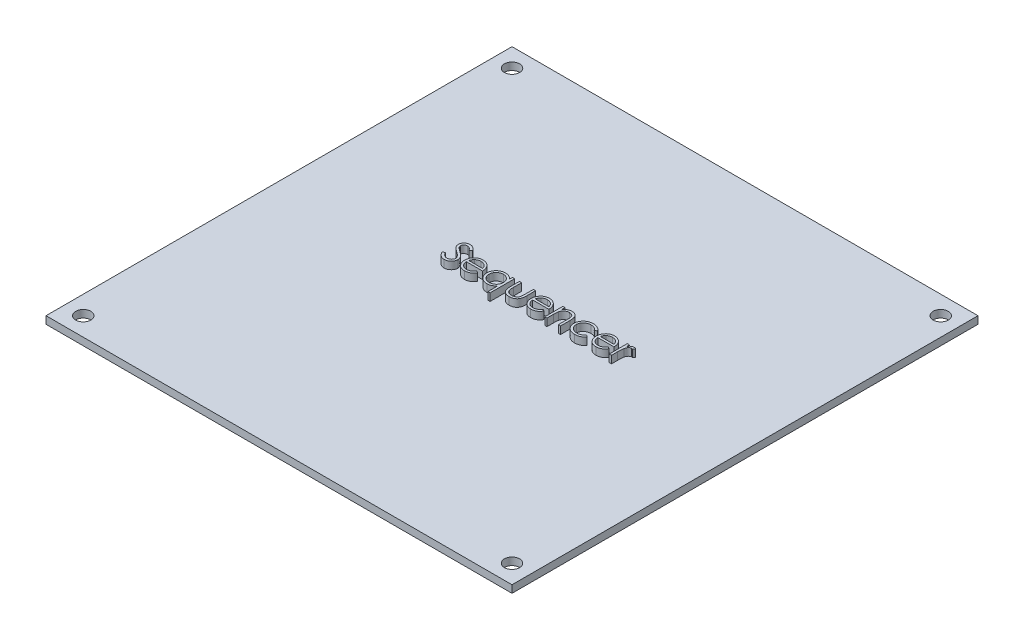
from build123d import *

# Parameters (mm, degrees)
SKETCH18_W            = 100
SKETCH18_H            = 100
BOSS_EXTRUDE6_DEPTH   = 1.6
F_4_CLEARANCE_HOLE3_D = 3.2639
BOSS_EXTRUDE8_DEPTH   = 1.6


with BuildPart() as part:
    # Sketch18 → Boss-Extrude6 (new body)
    with BuildSketch(Plane(origin=(0, 0, 0), x_dir=(1, 0, 0), z_dir=(0, 1, 0))):
        Rectangle(SKETCH18_W, SKETCH18_H)
    extrude(amount=BOSS_EXTRUDE6_DEPTH)

    # #4 Clearance Hole3 (through all)
    with Locations(Plane(origin=(0, 1.6, 0), x_dir=(1, 0, 0), z_dir=(0, 1, 0))):
        with Locations((-46, 46), (46, 46), (46, -46), (-46, -46)):
            Hole(F_4_CLEARANCE_HOLE3_D / 2)

    # Sketch25 → Boss-Extrude8 (add)
    # profile 1 of 9: a face of its own
    with BuildSketch(Plane(origin=(0, 1.6, 0), x_dir=(1, 0, 0), z_dir=(0, 1, 0))):
        with BuildLine():
            Line((-17.749736957, 2.733599717), (-17.302404559, 3.001787151))
            add(Edge.make_bspline(
                [(-17.302404559, 3.001787151), (-17.260799605, 2.932142188), (-17.181086119, 2.798705126), (-17.04811204, 2.618398327), (-16.910327757, 2.4651484), (-16.766712932, 2.339846862), (-16.618144177, 2.241196759), (-16.463651619, 2.171343385), (-16.303755882, 2.127776375), (-16.194938318, 2.122484577), (-16.140612358, 2.119842706)],
                knots=[0, 0, 0, 0, 1.272034388, 2.437168799, 3.508375237, 4.49857839, 5.41946034, 6.295179144, 7.148887113, 8, 8, 8, 8], degree=3))
            add(Edge.make_bspline(
                [(-16.140612358, 2.119842706), (-16.094216747, 2.12113489), (-16.00223734, 2.123696646), (-15.866827759, 2.148311669), (-15.735319558, 2.186127625), (-15.610423165, 2.240285462), (-15.493861938, 2.305809125), (-15.391647054, 2.38495156), (-15.303282097, 2.473558562), (-15.230999269, 2.572410909), (-15.175542549, 2.67872374), (-15.132918826, 2.787846905), (-15.109264965, 2.901494621), (-15.105701778, 2.978012821), (-15.103903624, 3.016627562)],
                knots=[0, 0, 0, 0, 1.095163259, 2.171163733, 3.241058638, 4.321873601, 5.38011039, 6.391990106, 7.366004449, 8.327778327, 9.272591725, 10.192022065, 11.087607919, 12, 12, 12, 12], degree=3))
            add(Edge.make_bspline(
                [(-15.103903624, 3.016627562), (-15.106132641, 3.060685751), (-15.110663908, 3.150249612), (-15.148962693, 3.282389564), (-15.209210959, 3.413158092), (-15.264792575, 3.494046911), (-15.293648883, 3.536041958)],
                knots=[0, 0, 0, 0, 0.938893495, 1.908633276, 2.914225137, 4, 4, 4, 4], degree=3))
            add(Edge.make_bspline(
                [(-15.293648883, 3.536041958), (-15.317341359, 3.566350846), (-15.367080749, 3.629980566), (-15.452590322, 3.724694196), (-15.552929566, 3.822391091), (-15.664664703, 3.926801808), (-15.79186592, 4.033070262), (-15.930549186, 4.146263968), (-16.084255259, 4.262078257), (-16.192053307, 4.339748684), (-16.247675325, 4.379825345)],
                knots=[0, 0, 0, 0, 0.722233717, 1.516239348, 2.393582979, 3.351407094, 4.387010283, 5.505090956, 6.712668013, 8, 8, 8, 8], degree=3))
            add(Edge.make_bspline(
                [(-16.247675325, 4.379825345), (-16.3033497, 4.419480472), (-16.409794866, 4.495298054), (-16.558654866, 4.607820483), (-16.691769709, 4.710696334), (-16.808547745, 4.804894066), (-16.908937612, 4.890426457), (-16.993730388, 4.96647215), (-17.060766064, 5.035087772), (-17.098042954, 5.079600277), (-17.114779358, 5.099585294)],
                knots=[0, 0, 0, 0, 1.452282411, 2.77665338, 3.964542531, 5.026858415, 5.96415736, 6.766646006, 7.446254459, 8, 8, 8, 8], degree=3))
            add(Edge.make_bspline(
                [(-17.114779358, 5.099585294), (-17.138172373, 5.1307321), (-17.184177876, 5.191986474), (-17.244905051, 5.287727628), (-17.296520214, 5.385734231), (-17.336982311, 5.486269646), (-17.371054928, 5.587922455), (-17.393972276, 5.692018981), (-17.408322364, 5.79809213), (-17.409791915, 5.869474447), (-17.410527555, 5.905207623)],
                knots=[0, 0, 0, 0, 1.068054152, 2.10047183, 3.106115577, 4.101338837, 5.06977816, 6.043150881, 7.020423561, 8, 8, 8, 8], degree=3))
            add(Edge.make_bspline(
                [(-17.410527555, 5.905207623), (-17.408554204, 5.961193116), (-17.404649679, 6.07196745), (-17.371628897, 6.233787873), (-17.319509165, 6.388284003), (-17.246491894, 6.533926294), (-17.152364706, 6.666922479), (-17.043438054, 6.788802394), (-16.91369926, 6.891262036), (-16.77134946, 6.980785029), (-16.61553804, 7.050855654), (-16.452266079, 7.103713326), (-16.281274078, 7.133663038), (-16.165457434, 7.137961027), (-16.106691418, 7.140141852)],
                knots=[0, 0, 0, 0, 1.005424448, 1.989358655, 2.955360095, 3.929531133, 4.905563448, 5.876582895, 6.856512386, 7.866279853, 8.892233794, 9.918561126, 10.94386622, 12, 12, 12, 12], degree=3))
            add(Edge.make_bspline(
                [(-16.106691418, 7.140141852), (-16.044334266, 7.137991089), (-15.920325794, 7.133713909), (-15.73791567, 7.096524784), (-15.56229173, 7.034989245), (-15.421014413, 6.965156393), (-15.310444643, 6.895410085), (-15.226121582, 6.831880113), (-15.140672579, 6.758741556), (-15.053408378, 6.675799601), (-14.965807619, 6.582293203), (-14.87656978, 6.478862757), (-14.785486183, 6.366140345), (-14.726891014, 6.285669969), (-14.696852342, 6.244417025)],
                knots=[0, 0, 0, 0, 1.286793592, 2.559021753, 3.825965368, 5.121522368, 5.803751409, 6.523245864, 7.299691795, 8.125521123, 9.008227632, 9.944561021, 10.946284179, 12, 12, 12, 12], degree=3))
            Line((-14.696852342, 6.244417025), (-15.126164241, 5.918988005))
            add(Edge.make_bspline(
                [(-15.126164241, 5.918988005), (-15.152087258, 5.952384002), (-15.202008927, 6.016696882), (-15.277799937, 6.106763038), (-15.349235393, 6.189035572), (-15.419615164, 6.260495944), (-15.485222202, 6.325057503), (-15.548899159, 6.380332374), (-15.609729666, 6.426862143), (-15.686408805, 6.476518478), (-15.782743927, 6.52574081), (-15.903672928, 6.567392393), (-16.030047415, 6.59242207), (-16.116119596, 6.595731459), (-16.159692887, 6.597406809)],
                knots=[0, 0, 0, 0, 1.181633172, 2.275549214, 3.290209073, 4.226197932, 5.078386478, 5.862611352, 6.581680152, 7.217281963, 8.414376989, 9.595101626, 10.782541182, 12, 12, 12, 12], degree=3))
            add(Edge.make_bspline(
                [(-16.159692887, 6.597406809), (-16.214358105, 6.595574834), (-16.319774829, 6.592042043), (-16.469438638, 6.553458256), (-16.604140168, 6.49270711), (-16.719880356, 6.407564226), (-16.816244595, 6.306688439), (-16.885951657, 6.190606123), (-16.927907263, 6.062423205), (-16.933026996, 5.973006653), (-16.935634393, 5.92746824)],
                knots=[0, 0, 0, 0, 1.14458467, 2.207223713, 3.21896685, 4.227309161, 5.202851033, 6.127160689, 7.046193047, 8, 8, 8, 8], degree=3))
            add(Edge.make_bspline(
                [(-16.935634393, 5.92746824), (-16.935040023, 5.899117791), (-16.933850311, 5.842370533), (-16.917257462, 5.758533264), (-16.89594062, 5.674907786), (-16.862160688, 5.591870072), (-16.815525527, 5.507967886), (-16.754285558, 5.42175645), (-16.677158289, 5.33247589), (-16.618077568, 5.274407599), (-16.586884727, 5.24374929)],
                knots=[0, 0, 0, 0, 0.858281714, 1.717966888, 2.583508476, 3.4729293, 4.427298488, 5.488583878, 6.674047936, 8, 8, 8, 8], degree=3))
            add(Edge.make_bspline(
                [(-16.586884727, 5.24374929), (-16.575301462, 5.233412358), (-16.547782274, 5.208854174), (-16.497472244, 5.168649178), (-16.431034918, 5.119054511), (-16.350205161, 5.057690354), (-16.253492602, 4.986507667), (-16.140886607, 4.90641661), (-16.013642385, 4.814817167), (-15.923348536, 4.750776599), (-15.875605013, 4.716914688)],
                knots=[0, 0, 0, 0, 0.420754252, 0.999615792, 1.744751191, 2.668019286, 3.750313428, 4.999500688, 6.413464383, 8, 8, 8, 8], degree=3))
            add(Edge.make_bspline(
                [(-15.875605013, 4.716914688), (-15.81817393, 4.675123585), (-15.706966597, 4.594200906), (-15.548734303, 4.472620056), (-15.405263903, 4.35371212), (-15.276051678, 4.238236453), (-15.159821114, 4.127068979), (-15.057861703, 4.018872266), (-14.969134544, 3.914421459), (-14.873613583, 3.78050816), (-14.776008308, 3.616041521), (-14.692186029, 3.414537517), (-14.639332337, 3.212250223), (-14.632420641, 3.076289411), (-14.629010461, 3.009207356)],
                knots=[0, 0, 0, 0, 1.163667725, 2.253281268, 3.268753668, 4.215851969, 5.092017293, 5.902905408, 6.650798638, 7.335211899, 8.59617414, 9.77448103, 10.901945474, 12, 12, 12, 12], degree=3))
            add(Edge.make_bspline(
                [(-14.629010461, 3.009207356), (-14.630003992, 2.961766257), (-14.631971759, 2.867805332), (-14.654591235, 2.729836346), (-14.687731681, 2.595834912), (-14.737680833, 2.467457397), (-14.798645608, 2.342355196), (-14.876004102, 2.223809918), (-14.965671673, 2.109197863), (-15.068532246, 2.001575204), (-15.18108736, 1.902777979), (-15.300049613, 1.814892374), (-15.425613716, 1.741612885), (-15.557098504, 1.681815779), (-15.69453418, 1.635047246), (-15.83787452, 1.601161123), (-15.987355804, 1.580363798), (-16.088956532, 1.578205159), (-16.140612358, 1.577107663)],
                knots=[0, 0, 0, 0, 0.983748083, 1.948392443, 2.894712957, 3.844097841, 4.80183111, 5.778335162, 6.776009319, 7.81870978, 8.863265674, 9.881300176, 10.883814829, 11.87499822, 12.874611388, 13.892143829, 14.928324115, 16, 16, 16, 16], degree=3))
            add(Edge.make_bspline(
                [(-16.140612358, 1.577107663), (-16.180580079, 1.577880521), (-16.260012168, 1.579416504), (-16.377501504, 1.592995344), (-16.492617312, 1.612207275), (-16.603915095, 1.642708547), (-16.712828801, 1.679715405), (-16.818884739, 1.725281694), (-16.922134308, 1.779887463), (-17.02315613, 1.842321607), (-17.121693275, 1.91498034), (-17.216821518, 1.999606936), (-17.311662072, 2.093867402), (-17.403415636, 2.200321468), (-17.493938128, 2.317249284), (-17.581444771, 2.445744835), (-17.667746892, 2.585108215), (-17.721896468, 2.683178047), (-17.749736957, 2.733599717)],
                knots=[0, 0, 0, 0, 0.915332311, 1.819136955, 2.706846663, 3.586547465, 4.459518054, 5.340707479, 6.227863349, 7.133153174, 8.059268498, 9.028702269, 10.047606654, 11.120612155, 12.245963614, 13.433783089, 14.680604001, 16, 16, 16, 16], degree=3))
        make_face()
    # profile 2 of 9: a face of its own
    with BuildSketch(Plane(origin=(0, 1.6, 0), x_dir=(1, 0, 0), z_dir=(0, 1, 0))):
        with BuildLine():
            Line((-10.505496172, 2.93394527), (-10.083604479, 2.71239913))
            add(Edge.make_bspline(
                [(-10.083604479, 2.71239913), (-10.117224093, 2.652764569), (-10.182634548, 2.536739331), (-10.295121393, 2.377336399), (-10.413037979, 2.233935686), (-10.541707074, 2.110368232), (-10.677279088, 2.002642924), (-10.82050584, 1.90839407), (-10.972132981, 1.828083926), (-11.132167684, 1.760422366), (-11.301953911, 1.708398488), (-11.481903108, 1.671652821), (-11.672360012, 1.648939069), (-11.802907212, 1.646300582), (-11.869753984, 1.644949544)],
                knots=[0, 0, 0, 0, 1.120438281, 2.179929193, 3.190490725, 4.156257408, 5.095198341, 6.022838206, 6.959905092, 7.901321166, 8.864066838, 9.862729781, 10.905609505, 12, 12, 12, 12], degree=3))
            add(Edge.make_bspline(
                [(-11.869753984, 1.644949544), (-11.944051974, 1.646683964), (-12.088985828, 1.650067314), (-12.299956636, 1.679235683), (-12.498589805, 1.726818892), (-12.684874166, 1.793290604), (-12.858353524, 1.880115248), (-13.019372673, 1.985887322), (-13.168778385, 2.110063469), (-13.301862606, 2.253719282), (-13.42167181, 2.407452718), (-13.52739299, 2.567647924), (-13.615775058, 2.733901847), (-13.687670076, 2.905156092), (-13.745734574, 3.080331264), (-13.786203281, 3.261021221), (-13.809531591, 3.446736926), (-13.813106407, 3.572372183), (-13.814907897, 3.63568472)],
                knots=[0, 0, 0, 0, 1.145258523, 2.234067595, 3.276747158, 4.290159414, 5.277019952, 6.260822364, 7.254936242, 8.264827045, 9.274100331, 10.257902744, 11.220704747, 12.172965371, 13.118907548, 14.062713208, 15.023725156, 16, 16, 16, 16], degree=3))
            add(Edge.make_bspline(
                [(-13.814907897, 3.63568472), (-13.813306577, 3.695094761), (-13.81013297, 3.812837617), (-13.79012928, 3.987108143), (-13.754677694, 4.156484494), (-13.706030156, 4.321107409), (-13.643208629, 4.480701255), (-13.566355155, 4.635363161), (-13.475350012, 4.784928551), (-13.405087756, 4.879276146), (-13.369695558, 4.926800505)],
                knots=[0, 0, 0, 0, 1.024358464, 2.0301432, 3.019427413, 4.004406732, 4.986367066, 5.972626655, 6.978780325, 8, 8, 8, 8], degree=3))
            add(Edge.make_bspline(
                [(-13.369695558, 4.926800505), (-13.321756561, 4.98405463), (-13.227397154, 5.096749215), (-13.067805997, 5.244822636), (-12.894994986, 5.36886501), (-12.71112979, 5.471685323), (-12.514073454, 5.549810956), (-12.306474883, 5.608030753), (-12.085970247, 5.640654651), (-11.935225448, 5.645262685), (-11.858093661, 5.647620484)],
                knots=[0, 0, 0, 0, 1.030682036, 2.02871468, 2.997146059, 3.962720338, 4.930598197, 5.918074684, 6.934738563, 8, 8, 8, 8], degree=3))
            add(Edge.make_bspline(
                [(-11.858093661, 5.647620484), (-11.778797877, 5.645573291), (-11.623237624, 5.641557165), (-11.396403346, 5.604324494), (-11.181772263, 5.545280751), (-10.979430262, 5.461893473), (-10.78935683, 5.354307007), (-10.612787445, 5.221044938), (-10.44670242, 5.066198544), (-10.350078736, 4.947116072), (-10.300910502, 4.886519389)],
                knots=[0, 0, 0, 0, 1.056321875, 2.072262726, 3.055038591, 4.01806755, 4.982017516, 5.957941055, 6.960871419, 8, 8, 8, 8], degree=3))
            add(Edge.make_bspline(
                [(-10.300910502, 4.886519389), (-10.267456678, 4.84085445), (-10.20077171, 4.749828533), (-10.117243356, 4.601403093), (-10.044736343, 4.446114456), (-9.986780556, 4.281452459), (-9.939851787, 4.109368094), (-9.905899215, 3.928631152), (-9.885988006, 3.739295452), (-9.882074142, 3.610289827), (-9.880078838, 3.544522193)],
                knots=[0, 0, 0, 0, 0.94817472, 1.890038105, 2.849395472, 3.817997239, 4.812318967, 5.836947057, 6.897266129, 8, 8, 8, 8], degree=3))
            Line((-9.880078838, 3.544522193), (-13.340014735, 3.544522193))
            add(Edge.make_bspline(
                [(-13.340014735, 3.544522193), (-13.337686997, 3.493570301), (-13.333109593, 3.39337546), (-13.311768841, 3.246764871), (-13.278130814, 3.107105175), (-13.230854969, 2.975443909), (-13.173603906, 2.850061455), (-13.10347312, 2.731887899), (-13.019804984, 2.621461504), (-12.926481606, 2.517794523), (-12.822603021, 2.425476467), (-12.713318391, 2.342848186), (-12.597062644, 2.273594486), (-12.474752447, 2.217382034), (-12.346585581, 2.173376056), (-12.212521667, 2.143337803), (-12.072824515, 2.123218725), (-11.977596084, 2.120981612), (-11.92911563, 2.119842706)],
                knots=[0, 0, 0, 0, 1.094153842, 2.151609401, 3.174256925, 4.172055639, 5.149267565, 6.128595816, 7.11444997, 8.118368179, 9.117203808, 10.09244225, 11.054858984, 12.015122123, 12.976791628, 13.957293641, 14.960065497, 16, 16, 16, 16], degree=3))
            add(Edge.make_bspline(
                [(-11.92911563, 2.119842706), (-11.88171568, 2.12076203), (-11.787665088, 2.122586145), (-11.647600935, 2.140323677), (-11.509806649, 2.169004927), (-11.374852544, 2.208148126), (-11.245477574, 2.255889319), (-11.12566585, 2.313497211), (-11.015477905, 2.377223614), (-10.912491539, 2.450112051), (-10.812598489, 2.53932681), (-10.713504492, 2.650657007), (-10.607252885, 2.782325055), (-10.54074481, 2.88142386), (-10.505496172, 2.93394527)],
                knots=[0, 0, 0, 0, 0.99110716, 1.966546729, 2.947904876, 3.932708344, 4.903319531, 5.828989031, 6.710028674, 7.56322171, 8.463672341, 9.504779593, 10.677557249, 12, 12, 12, 12], degree=3))
        make_face()
        with BuildLine():
            add(Edge.make_bspline(
                [(-10.354972, 4.019415356), (-10.372353801, 4.082405653), (-10.405808174, 4.203641698), (-10.475713153, 4.371524949), (-10.554440364, 4.520731657), (-10.647606553, 4.650119912), (-10.753165817, 4.765029985), (-10.875093652, 4.86544856), (-11.01182411, 4.955282087), (-11.16265043, 5.03110789), (-11.322370748, 5.095650891), (-11.489596776, 5.138929339), (-11.660227003, 5.1685771), (-11.775637174, 5.171338002), (-11.833712985, 5.172727322)],
                knots=[0, 0, 0, 0, 1.154881502, 2.222775134, 3.210006277, 4.132804581, 5.035138423, 5.962687519, 6.919655026, 7.923214229, 8.944639381, 9.960483929, 10.97369054, 12, 12, 12, 12], degree=3))
            add(Edge.make_bspline(
                [(-11.833712985, 5.172727322), (-11.881110351, 5.171802532), (-11.974804977, 5.169974419), (-12.112843497, 5.152632676), (-12.245406851, 5.123967196), (-12.373473179, 5.084710654), (-12.495364254, 5.032385743), (-12.613587296, 4.97102777), (-12.725136229, 4.896125613), (-12.794897473, 4.839037821), (-12.830140603, 4.810197274)],
                knots=[0, 0, 0, 0, 1.04873581, 2.073130211, 3.073294108, 4.04793562, 5.032784715, 6.005352987, 6.992311501, 8, 8, 8, 8], degree=3))
            add(Edge.make_bspline(
                [(-12.830140603, 4.810197274), (-12.855379256, 4.787376106), (-12.906456137, 4.741191624), (-12.974704306, 4.661621276), (-13.040049545, 4.575818319), (-13.099518282, 4.480500095), (-13.154064157, 4.376752013), (-13.205106027, 4.265449159), (-13.251047388, 4.145746927), (-13.276895078, 4.062331453), (-13.290193354, 4.019415356)],
                knots=[0, 0, 0, 0, 0.879870761, 1.780643979, 2.707998968, 3.669668524, 4.684282772, 5.740141944, 6.837334558, 8, 8, 8, 8], degree=3))
            Line((-13.290193354, 4.019415356), (-10.354972, 4.019415356))
        make_face(mode=Mode.SUBTRACT)
    # profile 3 of 9: a face of its own
    with BuildSketch(Plane(origin=(0, 1.6, 0), x_dir=(1, 0, 0), z_dir=(0, 1, 0))):
        with BuildLine():
            Line((-4.995463453, 5.579778604), (-4.995463453, 0.288111937))
            Line((-4.995463453, 0.288111937), (-5.470356615, 0.288111937))
            Line((-5.470356615, 0.288111937), (-5.470356615, 2.413470845))
            add(Edge.make_bspline(
                [(-5.470356615, 2.413470845), (-5.523983983, 2.352663143), (-5.628941888, 2.233652102), (-5.803370486, 2.076380958), (-5.987940686, 1.943480581), (-6.182512302, 1.834496834), (-6.385601885, 1.748495052), (-6.599220113, 1.689970833), (-6.821158501, 1.650771689), (-6.972953548, 1.646906375), (-7.049800392, 1.644949544)],
                knots=[0, 0, 0, 0, 1.069893489, 2.093963999, 3.093541679, 4.066938296, 5.033073547, 5.99758523, 6.986269586, 8, 8, 8, 8], degree=3))
            add(Edge.make_bspline(
                [(-7.049800392, 1.644949544), (-7.118090036, 1.646803702), (-7.252760239, 1.650460184), (-7.450863725, 1.678827), (-7.641503197, 1.72438163), (-7.824858801, 1.787731785), (-7.999744069, 1.871764693), (-8.167656358, 1.972368723), (-8.327725785, 2.092173312), (-8.477512516, 2.229133783), (-8.615446612, 2.377897633), (-8.736491631, 2.536565305), (-8.837415931, 2.704450693), (-8.921810577, 2.879428199), (-8.986816955, 3.062844804), (-9.032134235, 3.254066236), (-9.060468005, 3.452866402), (-9.064122976, 3.588241634), (-9.065976273, 3.656885308)],
                knots=[0, 0, 0, 0, 1.033919861, 2.038935746, 3.024066025, 3.998881131, 4.97069526, 5.957263378, 6.95902576, 7.993208707, 9.027059324, 10.027763471, 11.009749337, 11.988697705, 12.965288445, 13.950418724, 14.960734635, 16, 16, 16, 16], degree=3))
            add(Edge.make_bspline(
                [(-9.065976273, 3.656885308), (-9.0640819, 3.724110193), (-9.060336826, 3.857010164), (-9.032437315, 4.052467243), (-8.985521385, 4.240726995), (-8.919681187, 4.421183326), (-8.835253469, 4.594054592), (-8.732552671, 4.759463058), (-8.611571375, 4.917864409), (-8.472094522, 5.065534002), (-8.321002667, 5.201938978), (-8.159366848, 5.320485988), (-7.991207839, 5.422867414), (-7.813917335, 5.50398636), (-7.63011945, 5.569616792), (-7.438177931, 5.61502378), (-7.238891378, 5.641780444), (-7.103590277, 5.645655099), (-7.034959981, 5.647620484)],
                knots=[0, 0, 0, 0, 1.020392517, 2.01726096, 2.990465484, 3.961182959, 4.928053699, 5.906110375, 6.912531644, 7.948652711, 8.985773172, 9.998621852, 10.987621588, 11.969261332, 12.953316658, 13.946091881, 14.958173133, 16, 16, 16, 16], degree=3))
            add(Edge.make_bspline(
                [(-7.034959981, 5.647620484), (-6.956038765, 5.645446741), (-6.801277986, 5.641184132), (-6.574903496, 5.605710723), (-6.360750536, 5.545781136), (-6.15716598, 5.464263014), (-5.964880895, 5.355936959), (-5.785715668, 5.219291066), (-5.617795235, 5.055187128), (-5.520458366, 4.929138956), (-5.470356615, 4.864258772)],
                knots=[0, 0, 0, 0, 1.038897134, 2.037228247, 3.008116434, 3.962042015, 4.918381754, 5.904844433, 6.921570401, 8, 8, 8, 8], degree=3))
            Line((-5.470356615, 4.864258772), (-5.470356615, 5.579778604))
            Line((-5.470356615, 5.579778604), (-4.995463453, 5.579778604))
        make_face()
        with BuildLine():
            add(Edge.make_bspline(
                [(-7.028599804, 5.172727322), (-7.09801791, 5.170257417), (-7.23503821, 5.165382218), (-7.436188071, 5.127322291), (-7.628673828, 5.063996773), (-7.811532773, 4.977391994), (-7.981876387, 4.868491404), (-8.134115627, 4.73677217), (-8.269495664, 4.585828113), (-8.383354587, 4.416340398), (-8.476171171, 4.23464257), (-8.541435613, 4.044710384), (-8.584478403, 3.849969525), (-8.588875809, 3.717885464), (-8.591083111, 3.651585161)],
                knots=[0, 0, 0, 0, 1.031046209, 2.035121221, 3.029706178, 4.034933723, 5.034054252, 6.02443088, 7.017295772, 8.038157696, 9.050218397, 10.03989886, 11.016116709, 12, 12, 12, 12], degree=3))
            add(Edge.make_bspline(
                [(-8.591083111, 3.651585161), (-8.58826357, 3.58568107), (-8.582635539, 3.454131211), (-8.542191037, 3.259124863), (-8.474336943, 3.069147918), (-8.381744777, 2.885812844), (-8.265801903, 2.715596407), (-8.131410726, 2.561775031), (-7.977271611, 2.429499106), (-7.806535975, 2.31877087), (-7.62418821, 2.229322773), (-7.432427385, 2.167084246), (-7.234858266, 2.126901173), (-7.100521999, 2.1222075), (-7.032839922, 2.119842706)],
                knots=[0, 0, 0, 0, 0.979072187, 1.954306742, 2.945804271, 3.96968567, 4.997920485, 5.998718438, 6.996577872, 8.005894225, 9.015743152, 10.005417472, 10.995077863, 12, 12, 12, 12], degree=3))
            add(Edge.make_bspline(
                [(-7.032839922, 2.119842706), (-6.964129138, 2.122352414), (-6.827470204, 2.127343973), (-6.625723586, 2.165566838), (-6.429939535, 2.228717283), (-6.242785035, 2.316255249), (-6.068438027, 2.424745537), (-5.911959093, 2.551756258), (-5.779643284, 2.699474167), (-5.667471124, 2.861817138), (-5.579515434, 3.039786466), (-5.515446869, 3.229279825), (-5.477567749, 3.430303814), (-5.472793563, 3.567681418), (-5.470356615, 3.637804779)],
                knots=[0, 0, 0, 0, 1.01762866, 2.023962475, 3.030623092, 4.058876274, 5.077231937, 6.066672613, 7.034107872, 8.005628644, 8.981990164, 9.965428785, 10.961468474, 12, 12, 12, 12], degree=3))
            add(Edge.make_bspline(
                [(-5.470356615, 3.637804779), (-5.471807524, 3.691232213), (-5.474663372, 3.796394311), (-5.496481019, 3.950801391), (-5.531186682, 4.098565477), (-5.58009101, 4.239841924), (-5.644333786, 4.373849625), (-5.721815527, 4.501550787), (-5.813898766, 4.622281237), (-5.919101176, 4.734378499), (-6.034255708, 4.83662327), (-6.156106978, 4.927888253), (-6.286098655, 5.002861754), (-6.422044651, 5.064912248), (-6.564180836, 5.114289772), (-6.713663796, 5.14723069), (-6.868904646, 5.169849271), (-6.97480761, 5.17175787), (-7.028599804, 5.172727322)],
                knots=[0, 0, 0, 0, 1.050140795, 2.067009409, 3.05949893, 4.030605086, 5.00011959, 5.97591094, 6.962425594, 7.979863591, 8.993523472, 9.986985069, 10.967611495, 11.937549037, 12.921786183, 13.919465291, 14.943216303, 16, 16, 16, 16], degree=3))
        make_face(mode=Mode.SUBTRACT)
    # profile 4 of 9: a face of its own
    with BuildSketch(Plane(origin=(0, 1.6, 0), x_dir=(1, 0, 0), z_dir=(0, 1, 0))):
        with BuildLine():
            Line((-3.977835248, 5.579778604), (-3.502942085, 5.579778604))
            Line((-3.502942085, 5.579778604), (-3.502942085, 3.786208892))
            add(Edge.make_bspline(
                [(-3.502942085, 3.786208892), (-3.502727539, 3.733560212), (-3.502317121, 3.632845753), (-3.499533794, 3.487921839), (-3.492987104, 3.355756095), (-3.484801917, 3.236272172), (-3.474275831, 3.129490282), (-3.461752178, 3.035783397), (-3.447754327, 2.954088857), (-3.434052366, 2.904886402), (-3.427679999, 2.882003831)],
                knots=[0, 0, 0, 0, 1.388932606, 2.656963016, 3.823490214, 4.879454478, 5.816252168, 6.653371382, 7.373723809, 8, 8, 8, 8], degree=3))
            add(Edge.make_bspline(
                [(-3.427679999, 2.882003831), (-3.417457323, 2.853243061), (-3.397224498, 2.796319452), (-3.360525303, 2.714088457), (-3.315125318, 2.637925827), (-3.265444387, 2.56489467), (-3.208144092, 2.497158332), (-3.143949416, 2.434831202), (-3.075009224, 2.37555835), (-2.972570082, 2.305428962), (-2.832478096, 2.230264117), (-2.648550716, 2.165409725), (-2.449124089, 2.126650807), (-2.311291716, 2.122154017), (-2.240447093, 2.119842706)],
                knots=[0, 0, 0, 0, 0.725840625, 1.436591201, 2.137033971, 2.831655856, 3.53531722, 4.242432219, 4.957935707, 5.694543706, 7.190802206, 8.724350549, 10.316345118, 12, 12, 12, 12], degree=3))
            add(Edge.make_bspline(
                [(-2.240447093, 2.119842706), (-2.169609052, 2.122203165), (-2.032550549, 2.126770217), (-1.835315059, 2.164240567), (-1.655018278, 2.226842026), (-1.493469816, 2.314241327), (-1.351402415, 2.421196588), (-1.233013591, 2.546698002), (-1.135333575, 2.686775051), (-1.092683618, 2.791284377), (-1.071234687, 2.843842773)],
                knots=[0, 0, 0, 0, 1.157059328, 2.238695713, 3.266970494, 4.264342957, 5.228770407, 6.160125903, 7.074715775, 8, 8, 8, 8], degree=3))
            add(Edge.make_bspline(
                [(-1.071234687, 2.843842773), (-1.06489341, 2.864958486), (-1.050874397, 2.911640172), (-1.03581227, 2.990833363), (-1.022243739, 3.085273896), (-1.010657747, 3.195579759), (-1.002394941, 3.321462692), (-0.99794083, 3.462883355), (-0.992908794, 3.619397792), (-0.992832419, 3.728962142), (-0.992792513, 3.786208892)],
                knots=[0, 0, 0, 0, 0.557542046, 1.232589297, 2.036731608, 2.971723315, 4.038036528, 5.22795436, 6.551621927, 8, 8, 8, 8], degree=3))
            Line((-0.992792513, 3.786208892), (-0.992792513, 5.579778604))
            Line((-0.992792513, 5.579778604), (-0.51789935, 5.579778604))
            Line((-0.51789935, 5.579778604), (-0.51789935, 3.697166424))
            add(Edge.make_bspline(
                [(-0.51789935, 3.697166424), (-0.518567151, 3.63320201), (-0.519862775, 3.509102297), (-0.528189354, 3.328756081), (-0.542476268, 3.160689354), (-0.564161042, 3.004813152), (-0.589660336, 2.861246483), (-0.622553749, 2.729805345), (-0.66183037, 2.61089471), (-0.706137518, 2.502427976), (-0.758482484, 2.404083266), (-0.814161432, 2.310744591), (-0.878454837, 2.224727892), (-0.946143167, 2.141751327), (-1.021438528, 2.065942113), (-1.102929981, 1.995560715), (-1.189470533, 1.92953125), (-1.28298063, 1.870428959), (-1.382095153, 1.817184745), (-1.486936461, 1.769989008), (-1.598788684, 1.732641064), (-1.716208707, 1.700421367), (-1.839771814, 1.675150682), (-1.969358884, 1.657330515), (-2.104926268, 1.646406503), (-2.197317951, 1.645443352), (-2.244687211, 1.644949544)],
                knots=[0, 0, 0, 0, 1.493040784, 2.896703357, 4.213163133, 5.428574705, 6.569057535, 7.615249723, 8.588095153, 9.490268104, 10.346124644, 11.18633936, 12.024365274, 12.850166724, 13.684164916, 14.514361689, 15.362232829, 16.222528818, 17.093394965, 17.986930858, 18.902426812, 19.842810585, 20.827885679, 21.843828298, 22.894529745, 24, 24, 24, 24], degree=3))
            add(Edge.make_bspline(
                [(-2.244687211, 1.644949544), (-2.291702179, 1.645463149), (-2.384090967, 1.64647243), (-2.519665348, 1.657270163), (-2.649611455, 1.675122993), (-2.773467296, 1.700606476), (-2.891357159, 1.732415546), (-3.003758569, 1.77021851), (-3.109355384, 1.817209239), (-3.209416271, 1.870091974), (-3.303157977, 1.929910903), (-3.391012613, 1.995479248), (-3.472862378, 2.066699129), (-3.548725326, 2.14327311), (-3.617536613, 2.226151097), (-3.680153723, 2.314666408), (-3.737540646, 2.407941995), (-3.789478794, 2.507823205), (-3.834097757, 2.617545172), (-3.873490808, 2.738946735), (-3.905710463, 2.873358874), (-3.931930624, 3.02066667), (-3.953023873, 3.180165126), (-3.967668398, 3.352776897), (-3.975856618, 3.538081527), (-3.977161485, 3.666064098), (-3.977835248, 3.732147394)],
                knots=[0, 0, 0, 0, 1.083640291, 2.129454052, 3.13281866, 4.105697902, 5.042300162, 5.946461698, 6.836384745, 7.703652036, 8.553297018, 9.397182691, 10.228592656, 11.052265423, 11.879314572, 12.708807002, 13.549817954, 14.402308542, 15.300838682, 16.27712199, 17.341985831, 18.484375296, 19.725102775, 21.0496083, 22.476576903, 24, 24, 24, 24], degree=3))
            Line((-3.977835248, 3.732147394), (-3.977835248, 5.579778604))
        make_face()
    # profile 5 of 9: a face of its own
    with BuildSketch(Plane(origin=(0, 1.6, 0), x_dir=(1, 0, 0), z_dir=(0, 1, 0))):
        with BuildLine():
            Line((3.7412987, 2.93394527), (4.163190393, 2.71239913))
            add(Edge.make_bspline(
                [(4.163190393, 2.71239913), (4.129570779, 2.652764569), (4.064160323, 2.536739331), (3.951673478, 2.377336399), (3.833756892, 2.233935686), (3.705087798, 2.110368232), (3.569515783, 2.002642924), (3.426289031, 1.90839407), (3.27466189, 1.828083926), (3.114627187, 1.760422366), (2.944840961, 1.708398488), (2.764891764, 1.671652821), (2.57443486, 1.648939069), (2.44388766, 1.646300582), (2.377040887, 1.644949544)],
                knots=[0, 0, 0, 0, 1.120438281, 2.179929193, 3.190490725, 4.156257408, 5.095198341, 6.022838206, 6.959905092, 7.901321166, 8.864066838, 9.862729781, 10.905609505, 12, 12, 12, 12], degree=3))
            add(Edge.make_bspline(
                [(2.377040887, 1.644949544), (2.302742898, 1.646683964), (2.157809044, 1.650067314), (1.946838235, 1.679235683), (1.748205067, 1.726818892), (1.561920706, 1.793290604), (1.388441348, 1.880115248), (1.227422199, 1.985887322), (1.078016487, 2.110063469), (0.944932266, 2.253719282), (0.825123062, 2.407452718), (0.719401882, 2.567647924), (0.631019814, 2.733901847), (0.559124796, 2.905156092), (0.501060298, 3.080331264), (0.460591591, 3.261021221), (0.437263281, 3.446736926), (0.433688465, 3.572372183), (0.431886974, 3.63568472)],
                knots=[0, 0, 0, 0, 1.145258523, 2.234067595, 3.276747158, 4.290159414, 5.277019952, 6.260822364, 7.254936242, 8.264827045, 9.274100331, 10.257902744, 11.220704747, 12.172965371, 13.118907548, 14.062713208, 15.023725156, 16, 16, 16, 16], degree=3))
            add(Edge.make_bspline(
                [(0.431886974, 3.63568472), (0.433488295, 3.695094761), (0.436661902, 3.812837617), (0.456665592, 3.987108143), (0.492117178, 4.156484494), (0.540764715, 4.321107409), (0.603586242, 4.480701255), (0.680439717, 4.635363161), (0.771444859, 4.784928551), (0.841707116, 4.879276146), (0.877099314, 4.926800505)],
                knots=[0, 0, 0, 0, 1.024358464, 2.0301432, 3.019427413, 4.004406732, 4.986367066, 5.972626655, 6.978780325, 8, 8, 8, 8], degree=3))
            add(Edge.make_bspline(
                [(0.877099314, 4.926800505), (0.925038311, 4.98405463), (1.019397718, 5.096749215), (1.178988874, 5.244822636), (1.351799886, 5.36886501), (1.535665082, 5.471685323), (1.732721418, 5.549810956), (1.940319989, 5.608030753), (2.160824625, 5.640654651), (2.311569423, 5.645262685), (2.388701211, 5.647620484)],
                knots=[0, 0, 0, 0, 1.030682036, 2.02871468, 2.997146059, 3.962720338, 4.930598197, 5.918074684, 6.934738563, 8, 8, 8, 8], degree=3))
            add(Edge.make_bspline(
                [(2.388701211, 5.647620484), (2.467996995, 5.645573291), (2.623557248, 5.641557165), (2.850391526, 5.604324494), (3.065022609, 5.545280751), (3.26736461, 5.461893473), (3.457438042, 5.354307007), (3.634007426, 5.221044938), (3.800092451, 5.066198544), (3.896716136, 4.947116072), (3.94588437, 4.886519389)],
                knots=[0, 0, 0, 0, 1.056321875, 2.072262726, 3.055038591, 4.01806755, 4.982017516, 5.957941055, 6.960871419, 8, 8, 8, 8], degree=3))
            add(Edge.make_bspline(
                [(3.94588437, 4.886519389), (3.979338194, 4.84085445), (4.046023162, 4.749828533), (4.129551515, 4.601403093), (4.202058529, 4.446114456), (4.260014316, 4.281452459), (4.306943085, 4.109368094), (4.340895656, 3.928631152), (4.360806865, 3.739295452), (4.364720729, 3.610289827), (4.366716034, 3.544522193)],
                knots=[0, 0, 0, 0, 0.94817472, 1.890038105, 2.849395472, 3.817997239, 4.812318967, 5.836947057, 6.897266129, 8, 8, 8, 8], degree=3))
            Line((4.366716034, 3.544522193), (0.906780137, 3.544522193))
            add(Edge.make_bspline(
                [(0.906780137, 3.544522193), (0.909107875, 3.493570301), (0.913685279, 3.39337546), (0.935026031, 3.246764871), (0.968664058, 3.107105175), (1.015939902, 2.975443909), (1.073190966, 2.850061455), (1.143321752, 2.731887899), (1.226989887, 2.621461504), (1.320313266, 2.517794523), (1.424191851, 2.425476467), (1.533476481, 2.342848186), (1.649732228, 2.273594486), (1.772042425, 2.217382034), (1.900209291, 2.173376056), (2.034273205, 2.143337803), (2.173970357, 2.123218725), (2.269198788, 2.120981612), (2.317679242, 2.119842706)],
                knots=[0, 0, 0, 0, 1.094153842, 2.151609401, 3.174256925, 4.172055639, 5.149267565, 6.128595816, 7.11444997, 8.118368179, 9.117203808, 10.09244225, 11.054858984, 12.015122123, 12.976791628, 13.957293641, 14.960065497, 16, 16, 16, 16], degree=3))
            add(Edge.make_bspline(
                [(2.317679242, 2.119842706), (2.365079191, 2.12076203), (2.459129784, 2.122586145), (2.599193937, 2.140323677), (2.736988223, 2.169004927), (2.871942328, 2.208148126), (3.001317298, 2.255889319), (3.121129022, 2.313497211), (3.231316967, 2.377223614), (3.334303333, 2.450112051), (3.434196383, 2.53932681), (3.53329038, 2.650657007), (3.639541987, 2.782325055), (3.706050062, 2.88142386), (3.7412987, 2.93394527)],
                knots=[0, 0, 0, 0, 0.99110716, 1.966546729, 2.947904876, 3.932708344, 4.903319531, 5.828989031, 6.710028674, 7.56322171, 8.463672341, 9.504779593, 10.677557249, 12, 12, 12, 12], degree=3))
        make_face()
        with BuildLine():
            add(Edge.make_bspline(
                [(3.891822872, 4.019415356), (3.87444107, 4.082405653), (3.840986698, 4.203641698), (3.771081718, 4.371524949), (3.692354508, 4.520731657), (3.599188319, 4.650119912), (3.493629055, 4.765029985), (3.37170122, 4.86544856), (3.234970762, 4.955282087), (3.084144442, 5.03110789), (2.924424124, 5.095650891), (2.757198095, 5.138929339), (2.586567869, 5.1685771), (2.471157698, 5.171338002), (2.413081886, 5.172727322)],
                knots=[0, 0, 0, 0, 1.154881502, 2.222775134, 3.210006277, 4.132804581, 5.035138423, 5.962687519, 6.919655026, 7.923214229, 8.944639381, 9.960483929, 10.97369054, 12, 12, 12, 12], degree=3))
            add(Edge.make_bspline(
                [(2.413081886, 5.172727322), (2.365684521, 5.171802532), (2.271989894, 5.169974419), (2.133951375, 5.152632676), (2.00138802, 5.123967196), (1.873321693, 5.084710654), (1.751430618, 5.032385743), (1.633207575, 4.97102777), (1.521658643, 4.896125613), (1.451897399, 4.839037821), (1.416654269, 4.810197274)],
                knots=[0, 0, 0, 0, 1.04873581, 2.073130211, 3.073294108, 4.04793562, 5.032784715, 6.005352987, 6.992311501, 8, 8, 8, 8], degree=3))
            add(Edge.make_bspline(
                [(1.416654269, 4.810197274), (1.391415616, 4.787376106), (1.340338735, 4.741191624), (1.272090565, 4.661621276), (1.206745327, 4.575818319), (1.14727659, 4.480500095), (1.092730715, 4.376752013), (1.041688845, 4.265449159), (0.995747484, 4.145746927), (0.969899794, 4.062331453), (0.956601518, 4.019415356)],
                knots=[0, 0, 0, 0, 0.879870761, 1.780643979, 2.707998968, 3.669668524, 4.684282772, 5.740141944, 6.837334558, 8, 8, 8, 8], degree=3))
            Line((0.956601518, 4.019415356), (3.891822872, 4.019415356))
        make_face(mode=Mode.SUBTRACT)
    # profile 6 of 9: a face of its own
    with BuildSketch(Plane(origin=(0, 1.6, 0), x_dir=(1, 0, 0), z_dir=(0, 1, 0))):
        with BuildLine():
            Line((5.316502359, 5.579778604), (5.791395521, 5.579778604))
            Line((5.791395521, 5.579778604), (5.791395521, 4.882279271))
            add(Edge.make_bspline(
                [(5.791395521, 4.882279271), (5.842101232, 4.945541483), (5.940497432, 5.068304013), (6.104364221, 5.229655357), (6.277543689, 5.362620162), (6.45897529, 5.468610422), (6.648905317, 5.548509488), (6.846176035, 5.606212741), (7.051968507, 5.640812422), (7.19191712, 5.645333365), (7.262716301, 5.647620484)],
                knots=[0, 0, 0, 0, 1.12780773, 2.188550248, 3.19190651, 4.159438251, 5.104880172, 6.052711206, 7.014878035, 8, 8, 8, 8], degree=3))
            add(Edge.make_bspline(
                [(7.262716301, 5.647620484), (7.334275712, 5.644981915), (7.474334741, 5.639817598), (7.678257524, 5.598970934), (7.868717298, 5.529203703), (8.04503496, 5.433633073), (8.203977294, 5.314787572), (8.343563677, 5.176330687), (8.459017634, 5.017072561), (8.536423171, 4.869324456), (8.587413139, 4.738259255), (8.619514411, 4.62600524), (8.646775538, 4.500943274), (8.670409252, 4.363451276), (8.686400838, 4.212565917), (8.699013588, 4.048905716), (8.708052804, 3.872523685), (8.708411439, 3.750533189), (8.708596376, 3.68762616)],
                knots=[0, 0, 0, 0, 1.235846778, 2.418850247, 3.575807741, 4.728682307, 5.871620074, 6.994088408, 8.11269785, 9.256955736, 9.865816715, 10.540099792, 11.271859618, 12.076849838, 12.949306005, 13.892391288, 14.913166135, 16, 16, 16, 16], degree=3))
            Line((8.708596376, 3.68762616), (8.708596376, 1.712791424))
            Line((8.708596376, 1.712791424), (8.233703214, 1.712791424))
            Line((8.233703214, 1.712791424), (8.233703214, 3.531801841))
            add(Edge.make_bspline(
                [(8.233703214, 3.531801841), (8.233411102, 3.584450061), (8.232852341, 3.685157146), (8.231089994, 3.829346027), (8.226841834, 3.960105497), (8.220872361, 4.077122945), (8.212135017, 4.180286007), (8.203029372, 4.269804795), (8.191894229, 4.345565651), (8.181971729, 4.391172382), (8.177521657, 4.411626227)],
                knots=[0, 0, 0, 0, 1.430800155, 2.736877192, 3.918605307, 4.986035426, 5.920637409, 6.731861385, 7.431261377, 8, 8, 8, 8], degree=3))
            add(Edge.make_bspline(
                [(8.177521657, 4.411626227), (8.161456865, 4.471665756), (8.130537111, 4.587223275), (8.054134542, 4.743969022), (7.957653578, 4.877316282), (7.839879448, 4.986440612), (7.701949774, 5.071365567), (7.544247309, 5.130290475), (7.368293888, 5.167145072), (7.244537857, 5.170814665), (7.18003401, 5.172727322)],
                knots=[0, 0, 0, 0, 1.084156227, 2.086665306, 3.027808233, 3.945421172, 4.874247719, 5.839848303, 6.874090471, 8, 8, 8, 8], degree=3))
            add(Edge.make_bspline(
                [(7.18003401, 5.172727322), (7.141831679, 5.172007648), (7.066230252, 5.170583432), (6.954122557, 5.15629397), (6.845380057, 5.132922257), (6.738911407, 5.101370865), (6.636846053, 5.058036243), (6.535904803, 5.008854934), (6.439888624, 4.947549899), (6.346750154, 4.879225983), (6.260098647, 4.803510991), (6.179471279, 4.723615125), (6.107598319, 4.638531771), (6.042482584, 4.549631851), (5.986272591, 4.455694429), (5.937206612, 4.357625775), (5.895575264, 4.255296812), (5.874888336, 4.184274993), (5.864537549, 4.14873894)],
                knots=[0, 0, 0, 0, 1.023777757, 2.026029729, 3.023749952, 4.003683103, 4.997618607, 5.993177895, 7.010360494, 8.046726602, 9.087585522, 10.09234134, 11.086953743, 12.070360549, 13.043493632, 14.017870808, 15.008233677, 16, 16, 16, 16], degree=3))
            add(Edge.make_bspline(
                [(5.864537549, 4.14873894), (5.858581175, 4.122650717), (5.845614462, 4.065858018), (5.831609416, 3.972657527), (5.818897963, 3.864843636), (5.808258752, 3.742542157), (5.801749372, 3.605324893), (5.794651891, 3.453777853), (5.792067954, 3.287296746), (5.791625942, 3.171391567), (5.791395521, 3.110970177)],
                knots=[0, 0, 0, 0, 0.615963638, 1.340920617, 2.168419149, 3.115676021, 4.16674242, 5.331190069, 6.6087489, 8, 8, 8, 8], degree=3))
            Line((5.791395521, 3.110970177), (5.791395521, 1.712791424))
            Line((5.791395521, 1.712791424), (5.316502359, 1.712791424))
            Line((5.316502359, 1.712791424), (5.316502359, 5.579778604))
        make_face()
    # profile 7 of 9: a face of its own
    with BuildSketch(Plane(origin=(0, 1.6, 0), x_dir=(1, 0, 0), z_dir=(0, 1, 0))):
        with BuildLine():
            Line((13.593211761, 4.741295364), (13.195700743, 4.494308518))
            add(Edge.make_bspline(
                [(13.195700743, 4.494308518), (13.152112732, 4.548477637), (13.066317134, 4.655100352), (12.917335193, 4.792698703), (12.758567936, 4.910879826), (12.587302316, 5.00719383), (12.403778547, 5.081611976), (12.208720379, 5.134271929), (12.002155627, 5.167086677), (11.860542767, 5.1708163), (11.787981726, 5.172727322)],
                knots=[0, 0, 0, 0, 1.026593902, 2.0206758, 2.988051866, 3.946915611, 4.916868779, 5.907761954, 6.927957743, 8, 8, 8, 8], degree=3))
            add(Edge.make_bspline(
                [(11.787981726, 5.172727322), (11.729986636, 5.171129477), (11.615766884, 5.167982565), (11.448087343, 5.148311938), (11.288366166, 5.112567473), (11.135602237, 5.065470193), (10.990882081, 5.002347731), (10.853826525, 4.925528219), (10.723219892, 4.836250182), (10.602846961, 4.732819953), (10.492736439, 4.620336253), (10.39733689, 4.499756261), (10.314277479, 4.374691663), (10.249105378, 4.242019387), (10.19577268, 4.104774639), (10.160686329, 3.960366786), (10.137305183, 3.81064587), (10.134630126, 3.708564571), (10.133275863, 3.656885308)],
                knots=[0, 0, 0, 0, 1.112346261, 2.190735716, 3.231507886, 4.247384806, 5.251966152, 6.253067467, 7.256802811, 8.280671706, 9.291813951, 10.270744147, 11.225547591, 12.165006084, 13.100104208, 14.043489273, 15.009504848, 16, 16, 16, 16], degree=3))
            add(Edge.make_bspline(
                [(10.133275863, 3.656885308), (10.135965923, 3.589198524), (10.141309797, 3.454736978), (10.183191766, 3.256256991), (10.251748191, 3.064360459), (10.345573751, 2.880409823), (10.464223704, 2.710178184), (10.603579841, 2.557500818), (10.763719408, 2.425336109), (10.943231384, 2.315764553), (11.13790083, 2.227678914), (11.345621583, 2.16492378), (11.564696251, 2.127046978), (11.714687405, 2.122275493), (11.791161814, 2.119842706)],
                knots=[0, 0, 0, 0, 0.966302908, 1.919585723, 2.883856336, 3.870342332, 4.860282998, 5.839159637, 6.814385684, 7.815993281, 8.834850808, 9.858348828, 10.908058873, 12, 12, 12, 12], degree=3))
            add(Edge.make_bspline(
                [(11.791161814, 2.119842706), (11.861246438, 2.121807422), (11.998981322, 2.125668611), (12.200317575, 2.158218353), (12.391996726, 2.21150337), (12.574011963, 2.285809936), (12.74603069, 2.38185749), (12.906941466, 2.500329094), (13.059946135, 2.637816573), (13.149899897, 2.744130648), (13.195700743, 2.79826151)],
                knots=[0, 0, 0, 0, 1.039848629, 2.043578496, 3.018386758, 3.987534228, 4.954977003, 5.934852016, 6.948509513, 8, 8, 8, 8], degree=3))
            Line((13.195700743, 2.79826151), (13.593211761, 2.537494282))
            add(Edge.make_bspline(
                [(13.593211761, 2.537494282), (13.56964464, 2.502885683), (13.522588619, 2.433783355), (13.443927805, 2.336349988), (13.359079964, 2.24514935), (13.268376115, 2.160303688), (13.173000612, 2.079782636), (13.06969532, 2.007435612), (12.961791265, 1.939196059), (12.848021705, 1.877793264), (12.729562911, 1.822599183), (12.60658157, 1.775138722), (12.479612091, 1.734362491), (12.348505189, 1.701951264), (12.213002391, 1.676081306), (12.073454134, 1.65891559), (11.929908481, 1.646101772), (11.832886299, 1.64533695), (11.783741609, 1.644949544)],
                knots=[0, 0, 0, 0, 0.954134338, 1.905101784, 2.851144739, 3.791306361, 4.734911809, 5.6936923, 6.663572882, 7.643865596, 8.638447847, 9.640600242, 10.646758161, 11.676244097, 12.717260333, 13.78922464, 14.880174919, 16, 16, 16, 16], degree=3))
            add(Edge.make_bspline(
                [(11.783741609, 1.644949544), (11.708734677, 1.646297074), (11.561720548, 1.648938243), (11.346542471, 1.677979628), (11.140902759, 1.721760786), (10.944871671, 1.784601194), (10.758418685, 1.865495318), (10.581717661, 1.964308748), (10.415353682, 2.08186205), (10.260971903, 2.216062903), (10.119183288, 2.361569587), (9.997435357, 2.518580772), (9.89183596, 2.681323785), (9.807036936, 2.853392949), (9.739535036, 3.03250131), (9.693414634, 3.220083697), (9.66358515, 3.414593652), (9.660132897, 3.547237415), (9.658382701, 3.614484133)],
                knots=[0, 0, 0, 0, 1.1129367, 2.181364009, 3.217532258, 4.231199276, 5.232079859, 6.230262199, 7.231623845, 8.250719726, 9.263571943, 10.242672461, 11.195837495, 12.138959767, 13.085126421, 14.0317438, 15.002148558, 16, 16, 16, 16], degree=3))
            add(Edge.make_bspline(
                [(9.658382701, 3.614484133), (9.659049475, 3.660111051), (9.6603758, 3.750870524), (9.675588476, 3.88557378), (9.695240929, 4.018483128), (9.728541746, 4.147913846), (9.767005558, 4.275828987), (9.816105469, 4.400686771), (9.873702078, 4.523067408), (9.939094903, 4.642655642), (10.012707649, 4.757484112), (10.094170942, 4.865968819), (10.180416546, 4.969412989), (10.275479239, 5.064245341), (10.375324906, 5.154258392), (10.48277836, 5.237047461), (10.597223278, 5.312855864), (10.716940921, 5.383085376), (10.841861615, 5.445616902), (10.971230272, 5.499490964), (11.104267352, 5.545532359), (11.241185665, 5.581982749), (11.381076427, 5.612549567), (11.525042021, 5.63177774), (11.67253169, 5.645364129), (11.772402106, 5.646862112), (11.822962696, 5.647620484)],
                knots=[0, 0, 0, 0, 0.990994727, 1.971252077, 2.943264845, 3.907940874, 4.872158414, 5.844625996, 6.82015047, 7.809835459, 8.804511986, 9.781214284, 10.756496977, 11.728388426, 12.696359165, 13.676225489, 14.672885716, 15.677705647, 16.690706858, 17.706033469, 18.721040654, 19.747369689, 20.783475414, 21.830280724, 22.901553713, 24, 24, 24, 24], degree=3))
            add(Edge.make_bspline(
                [(11.822962696, 5.647620484), (11.88628143, 5.646226673), (12.012602403, 5.643446016), (12.199988948, 5.620043768), (12.384615491, 5.584761329), (12.563242659, 5.532490503), (12.733704651, 5.469196643), (12.893264201, 5.398117896), (13.03816531, 5.315576055), (13.171103451, 5.22528493), (13.292327245, 5.123441656), (13.403081061, 5.008828756), (13.505636055, 4.882042722), (13.56377894, 4.788598343), (13.593211761, 4.741295364)],
                knots=[0, 0, 0, 0, 1.095225653, 2.184976855, 3.262915854, 4.344593502, 5.400796181, 6.407717688, 7.363229445, 8.282371371, 9.184954523, 10.097238608, 11.036792983, 12, 12, 12, 12], degree=3))
        make_face()
    # profile 8 of 9: a face of its own
    with BuildSketch(Plane(origin=(0, 1.6, 0), x_dir=(1, 0, 0), z_dir=(0, 1, 0))):
        with BuildLine():
            Line((17.71672605, 2.93394527), (18.138617744, 2.71239913))
            add(Edge.make_bspline(
                [(18.138617744, 2.71239913), (18.104998129, 2.652764569), (18.039587674, 2.536739331), (17.927100829, 2.377336399), (17.809184243, 2.233935686), (17.680515148, 2.110368232), (17.544943134, 2.002642924), (17.401716382, 1.90839407), (17.250089241, 1.828083926), (17.090054538, 1.760422366), (16.920268312, 1.708398488), (16.740319114, 1.671652821), (16.549862211, 1.648939069), (16.41931501, 1.646300582), (16.352468238, 1.644949544)],
                knots=[0, 0, 0, 0, 1.120438281, 2.179929193, 3.190490725, 4.156257408, 5.095198341, 6.022838206, 6.959905092, 7.901321166, 8.864066838, 9.862729781, 10.905609505, 12, 12, 12, 12], degree=3))
            add(Edge.make_bspline(
                [(16.352468238, 1.644949544), (16.278170248, 1.646683964), (16.133236394, 1.650067314), (15.922265586, 1.679235683), (15.723632418, 1.726818892), (15.537348057, 1.793290604), (15.363868699, 1.880115248), (15.202849549, 1.985887322), (15.053443837, 2.110063469), (14.920359616, 2.253719282), (14.800550413, 2.407452718), (14.694829232, 2.567647924), (14.606447164, 2.733901847), (14.534552146, 2.905156092), (14.476487648, 3.080331264), (14.436018941, 3.261021221), (14.412690632, 3.446736926), (14.409115815, 3.572372183), (14.407314325, 3.63568472)],
                knots=[0, 0, 0, 0, 1.145258523, 2.234067595, 3.276747158, 4.290159414, 5.277019952, 6.260822364, 7.254936242, 8.264827045, 9.274100331, 10.257902744, 11.220704747, 12.172965371, 13.118907548, 14.062713208, 15.023725156, 16, 16, 16, 16], degree=3))
            add(Edge.make_bspline(
                [(14.407314325, 3.63568472), (14.408915646, 3.695094761), (14.412089252, 3.812837617), (14.432092943, 3.987108143), (14.467544529, 4.156484494), (14.516192066, 4.321107409), (14.579013593, 4.480701255), (14.655867067, 4.635363161), (14.74687221, 4.784928551), (14.817134467, 4.879276146), (14.852526665, 4.926800505)],
                knots=[0, 0, 0, 0, 1.024358464, 2.0301432, 3.019427413, 4.004406732, 4.986367066, 5.972626655, 6.978780325, 8, 8, 8, 8], degree=3))
            add(Edge.make_bspline(
                [(14.852526665, 4.926800505), (14.900465661, 4.98405463), (14.994825069, 5.096749215), (15.154416225, 5.244822636), (15.327227236, 5.36886501), (15.511092433, 5.471685323), (15.708148768, 5.549810956), (15.915747339, 5.608030753), (16.136251976, 5.640654651), (16.286996774, 5.645262685), (16.364128561, 5.647620484)],
                knots=[0, 0, 0, 0, 1.030682036, 2.02871468, 2.997146059, 3.962720338, 4.930598197, 5.918074684, 6.934738563, 8, 8, 8, 8], degree=3))
            add(Edge.make_bspline(
                [(16.364128561, 5.647620484), (16.443424345, 5.645573291), (16.598984598, 5.641557165), (16.825818876, 5.604324494), (17.04044996, 5.545280751), (17.24279196, 5.461893473), (17.432865392, 5.354307007), (17.609434777, 5.221044938), (17.775519802, 5.066198544), (17.872143487, 4.947116072), (17.921311721, 4.886519389)],
                knots=[0, 0, 0, 0, 1.056321875, 2.072262726, 3.055038591, 4.01806755, 4.982017516, 5.957941055, 6.960871419, 8, 8, 8, 8], degree=3))
            add(Edge.make_bspline(
                [(17.921311721, 4.886519389), (17.954765544, 4.84085445), (18.021450512, 4.749828533), (18.104978866, 4.601403093), (18.17748588, 4.446114456), (18.235441666, 4.281452459), (18.282370436, 4.109368094), (18.316323007, 3.928631152), (18.336234216, 3.739295452), (18.34014808, 3.610289827), (18.342143385, 3.544522193)],
                knots=[0, 0, 0, 0, 0.94817472, 1.890038105, 2.849395472, 3.817997239, 4.812318967, 5.836947057, 6.897266129, 8, 8, 8, 8], degree=3))
            Line((18.342143385, 3.544522193), (14.882207487, 3.544522193))
            add(Edge.make_bspline(
                [(14.882207487, 3.544522193), (14.884535226, 3.493570301), (14.889112629, 3.39337546), (14.910453381, 3.246764871), (14.944091408, 3.107105175), (14.991367253, 2.975443909), (15.048618317, 2.850061455), (15.118749103, 2.731887899), (15.202417238, 2.621461504), (15.295740617, 2.517794523), (15.399619201, 2.425476467), (15.508903831, 2.342848186), (15.625159578, 2.273594486), (15.747469776, 2.217382034), (15.875636641, 2.173376056), (16.009700555, 2.143337803), (16.149397708, 2.123218725), (16.244626139, 2.120981612), (16.293106593, 2.119842706)],
                knots=[0, 0, 0, 0, 1.094153842, 2.151609401, 3.174256925, 4.172055639, 5.149267565, 6.128595816, 7.11444997, 8.118368179, 9.117203808, 10.09244225, 11.054858984, 12.015122123, 12.976791628, 13.957293641, 14.960065497, 16, 16, 16, 16], degree=3))
            add(Edge.make_bspline(
                [(16.293106593, 2.119842706), (16.340506542, 2.12076203), (16.434557134, 2.122586145), (16.574621287, 2.140323677), (16.712415573, 2.169004927), (16.847369679, 2.208148126), (16.976744648, 2.255889319), (17.096556373, 2.313497211), (17.206744318, 2.377223614), (17.309730684, 2.450112051), (17.409623733, 2.53932681), (17.50871773, 2.650657007), (17.614969337, 2.782325055), (17.681477412, 2.88142386), (17.71672605, 2.93394527)],
                knots=[0, 0, 0, 0, 0.99110716, 1.966546729, 2.947904876, 3.932708344, 4.903319531, 5.828989031, 6.710028674, 7.56322171, 8.463672341, 9.504779593, 10.677557249, 12, 12, 12, 12], degree=3))
        make_face()
        with BuildLine():
            add(Edge.make_bspline(
                [(17.867250222, 4.019415356), (17.849868421, 4.082405653), (17.816414048, 4.203641698), (17.746509069, 4.371524949), (17.667781859, 4.520731657), (17.574615669, 4.650119912), (17.469056406, 4.765029985), (17.34712857, 4.86544856), (17.210398112, 4.955282087), (17.059571792, 5.03110789), (16.899851474, 5.095650891), (16.732625446, 5.138929339), (16.561995219, 5.1685771), (16.446585048, 5.171338002), (16.388509237, 5.172727322)],
                knots=[0, 0, 0, 0, 1.154881502, 2.222775134, 3.210006277, 4.132804581, 5.035138423, 5.962687519, 6.919655026, 7.923214229, 8.944639381, 9.960483929, 10.97369054, 12, 12, 12, 12], degree=3))
            add(Edge.make_bspline(
                [(16.388509237, 5.172727322), (16.341111871, 5.171802532), (16.247417245, 5.169974419), (16.109378725, 5.152632676), (15.976815371, 5.123967196), (15.848749043, 5.084710654), (15.726857968, 5.032385743), (15.608634926, 4.97102777), (15.497085993, 4.896125613), (15.427324749, 4.839037821), (15.392081619, 4.810197274)],
                knots=[0, 0, 0, 0, 1.04873581, 2.073130211, 3.073294108, 4.04793562, 5.032784715, 6.005352987, 6.992311501, 8, 8, 8, 8], degree=3))
            add(Edge.make_bspline(
                [(15.392081619, 4.810197274), (15.366842967, 4.787376106), (15.315766085, 4.741191624), (15.247517916, 4.661621276), (15.182172677, 4.575818319), (15.12270394, 4.480500095), (15.068158066, 4.376752013), (15.017116195, 4.265449159), (14.971174834, 4.145746927), (14.945327144, 4.062331453), (14.932028868, 4.019415356)],
                knots=[0, 0, 0, 0, 0.879870761, 1.780643979, 2.707998968, 3.669668524, 4.684282772, 5.740141944, 6.837334558, 8, 8, 8, 8], degree=3))
            Line((14.932028868, 4.019415356), (17.867250222, 4.019415356))
        make_face(mode=Mode.SUBTRACT)
    # profile 9 of 9: a face of its own
    with BuildSketch(Plane(origin=(0, 1.6, 0), x_dir=(1, 0, 0), z_dir=(0, 1, 0))):
        with BuildLine():
            Line((19.156245949, 5.579778604), (19.631139111, 5.579778604))
            Line((19.631139111, 5.579778604), (19.631139111, 5.010542826))
            add(Edge.make_bspline(
                [(19.631139111, 5.010542826), (19.666198306, 5.0635439), (19.733248744, 5.164908042), (19.844695672, 5.29896758), (19.958849519, 5.409964139), (20.076256766, 5.498415888), (20.197780798, 5.564657151), (20.320754523, 5.613178763), (20.447112674, 5.641870656), (20.532024154, 5.645701307), (20.57456526, 5.647620484)],
                knots=[0, 0, 0, 0, 1.2804753, 2.448899062, 3.506932113, 4.484331642, 5.4025378, 6.288909075, 7.142734305, 8, 8, 8, 8], degree=3))
            add(Edge.make_bspline(
                [(20.57456526, 5.647620484), (20.607564587, 5.645820521), (20.675462846, 5.642116981), (20.778246048, 5.616095853), (20.884145076, 5.5745517), (20.952396066, 5.535483744), (20.987976718, 5.515116811)],
                knots=[0, 0, 0, 0, 0.901110191, 1.854092781, 2.881294221, 4, 4, 4, 4], degree=3))
            Line((20.987976718, 5.515116811), (20.72720949, 5.103825412))
            add(Edge.make_bspline(
                [(20.72720949, 5.103825412), (20.704366089, 5.114016052), (20.661004941, 5.133359839), (20.597573633, 5.156253116), (20.539091136, 5.169733132), (20.501832422, 5.171775288), (20.484462762, 5.172727322)],
                knots=[0, 0, 0, 0, 1.180555205, 2.24091978, 3.179933427, 4, 4, 4, 4], degree=3))
            add(Edge.make_bspline(
                [(20.484462762, 5.172727322), (20.446354094, 5.170187265), (20.368623457, 5.165006286), (20.254498083, 5.124277374), (20.143755284, 5.058471357), (20.05580527, 4.985490033), (19.987705674, 4.915114196), (19.939112714, 4.853657683), (19.894537608, 4.784747133), (19.851946918, 4.709560587), (19.813141925, 4.626814272), (19.776924747, 4.53733489), (19.744178609, 4.441018802), (19.725506216, 4.373916659), (19.715941462, 4.339544229)],
                knots=[0, 0, 0, 0, 1.125678352, 2.296057538, 3.5422874, 4.923748041, 5.663163013, 6.437101912, 7.23742474, 8.08941207, 8.991984279, 9.93940061, 10.944477711, 12, 12, 12, 12], degree=3))
            add(Edge.make_bspline(
                [(19.715941462, 4.339544229), (19.708786534, 4.308887073), (19.692938912, 4.240983804), (19.677530277, 4.127064011), (19.662306125, 3.992468717), (19.651576714, 3.836823273), (19.641631341, 3.660516364), (19.63602205, 3.463279398), (19.631330397, 3.244909927), (19.631204807, 3.092246322), (19.631139111, 3.012387444)],
                knots=[0, 0, 0, 0, 0.566838948, 1.255505196, 2.06880316, 3.007127437, 4.065329342, 5.249902469, 6.561414163, 8, 8, 8, 8], degree=3))
            Line((19.631139111, 3.012387444), (19.631139111, 1.712791424))
            Line((19.631139111, 1.712791424), (19.156245949, 1.712791424))
            Line((19.156245949, 1.712791424), (19.156245949, 5.579778604))
        make_face()
    extrude(amount=BOSS_EXTRUDE8_DEPTH)


solid = part.part
